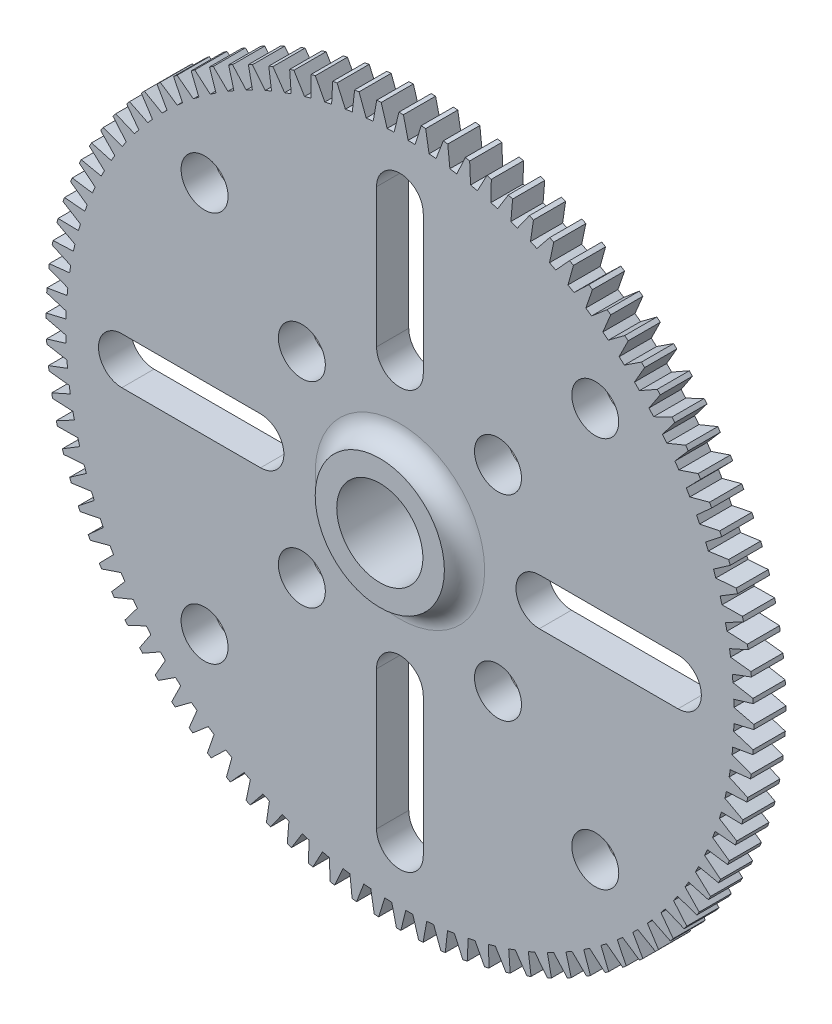
from build123d import *

# Parameters (mm, degrees)
SKETCH1_R          = 32.1437
EXTRUDE1_DEPTH     = 2.921
CUT_EXTRUDE1_DEPTH = 46.551807213
CIRPATTERN1_COUNT  = 100
SKETCH4_R          = 5.8674
EXTRUDE2_DEPTH     = 1.8288
FILLET1_R          = 1.8288
FILLET2_R          = 1.8288
SKETCH5_R          = 3.9116
CUT_EXTRUDE3_DEPTH = 46.931610872
CUT_EXTRUDE4_REACH = 47.706
CIRPATTERN2_COUNT  = 4
CUT_EXTRUDE5_REACH = 47.706
SKETCH7_R          = 2.1336
CIRPATTERN3_COUNT  = 4


with BuildPart() as part:
    # Sketch1 → Extrude1 (new body)
    with BuildSketch(Plane.XY):
        Circle(SKETCH1_R)
    extrude(amount=EXTRUDE1_DEPTH)

    # Sketch3 → Cut-Extrude1 (cut, through all)
    with BuildSketch(Plane(origin=(0, 0, 0), x_dir=(-1, 0, 0), z_dir=(0, 0, -1))):
        with BuildLine():
            Line((0.743775686, -30.337596874), (0.3175, -32.142131906))
            ThreePointArc((0.3175, -32.142131906), (1.123975208, -32.124042856), (1.929742527, -32.085721801))
            Line((1.929742527, -32.085721801), (1.378387358, -30.315392702))
            ThreePointArc((1.378387358, -30.315392702), (1.061139601, -30.328154727), (0.743775686, -30.337596874))
        make_face()
    cut_extrude1 = extrude(amount=-CUT_EXTRUDE1_DEPTH, mode=Mode.SUBTRACT)

    # CirPattern1: Cut-Extrude1 ×100 about axis
    cirpattern1_axis = Axis((0, 0, 0), (0, 0, 1))
    for i in range(1, CIRPATTERN1_COUNT):
        add(cut_extrude1.rotate(cirpattern1_axis, i * 360 / CIRPATTERN1_COUNT), mode=Mode.SUBTRACT)

    # Sketch4 → Extrude2 (add)
    with BuildSketch(Plane(origin=(0, 0, 0), x_dir=(-1, 0, 0), z_dir=(0, 0, -1))):
        with Locations(Location((0, 0, 0), (0, 0, 180))):
            Circle(SKETCH4_R)
    extrude2 = extrude(amount=EXTRUDE2_DEPTH)

    # Fillet1
    fillet1_edges = [part.edges().sort_by_distance(p)[0] for p in [
        (-5.8674, 0, 0),
    ]]
    fillet(fillet1_edges, radius=FILLET1_R - 0.0001)  # a hair under: the kernel refuses the full size

    # Mirror3: Extrude2 across plane
    add(extrude2.mirror(Plane(origin=(0, 0, 1.4605), x_dir=(1, 0, 0), z_dir=(0, 0, -1))))

    # Fillet2
    fillet2_edges = [part.edges().sort_by_distance(p)[0] for p in [
        (-5.8674, 0, 2.921),
    ]]
    fillet(fillet2_edges, radius=FILLET2_R - 0.0001)  # a hair under: the kernel refuses the full size

    # Sketch5 → Cut-Extrude3 (cut, through all)
    with BuildSketch(Plane(origin=(0, 0, -1.8288), x_dir=(-1, 0, 0), z_dir=(0, 0, -1))):
        Circle(SKETCH5_R)
    extrude(amount=-CUT_EXTRUDE3_DEPTH, mode=Mode.SUBTRACT)

    # Sketch6 → Cut-Extrude4 (cut, up to next)
    with BuildSketch(Plane.XY.offset(2.921), mode=Mode.PRIVATE) as cut_extrude4_sk1:
        with BuildLine():
            Line((-25.2603, -2.1209), (-12.6619, -2.1209))
            ThreePointArc((-12.6619, -2.1209), (-10.541, 0), (-12.6619, 2.1209))
            Line((-12.6619, 2.1209), (-25.2603, 2.1209))
            ThreePointArc((-25.2603, 2.1209), (-27.3812, 0), (-25.2603, -2.1209))
        make_face()
    cut_extrude4_tool1 = extrude(cut_extrude4_sk1.sketch, amount=-CUT_EXTRUDE4_REACH, mode=Mode.PRIVATE) & part.part
    cut_extrude4 = cut_extrude4_tool1.solids().sort_by_distance((-18.9611, 0, 2.921))[0]
    add(cut_extrude4, mode=Mode.SUBTRACT)

    # CirPattern2: Cut-Extrude4 ×4 about axis
    cirpattern2_axis = Axis((0, 0, 0), (0, 0, 1))
    for i in range(1, CIRPATTERN2_COUNT):
        add(cut_extrude4.rotate(cirpattern2_axis, i * 360 / CIRPATTERN2_COUNT), mode=Mode.SUBTRACT)

    # Sketch7 → Cut-Extrude5 (cut, up to next)
    with BuildSketch(Plane.XY.offset(2.921), mode=Mode.PRIVATE) as cut_extrude5_sk1:
        with Locations((-8.908414072, 8.908414072)):
            Circle(SKETCH7_R)
    cut_extrude5_tool1 = extrude(cut_extrude5_sk1.sketch, amount=-CUT_EXTRUDE5_REACH, mode=Mode.PRIVATE) & part.part
    # Sketch7 → Cut-Extrude5 (cut, up to next)
    with BuildSketch(Plane.XY.offset(2.921), mode=Mode.PRIVATE) as cut_extrude5_sk2:
        with Locations((-17.744986095, 17.744986095)):
            Circle(SKETCH7_R)
    cut_extrude5_tool2 = extrude(cut_extrude5_sk2.sketch, amount=-CUT_EXTRUDE5_REACH, mode=Mode.PRIVATE) & part.part
    cut_extrude5_1 = cut_extrude5_tool1.solids().sort_by_distance((-8.908414, 8.908414, 2.921))[0]
    add(cut_extrude5_1, mode=Mode.SUBTRACT)
    cut_extrude5_2 = cut_extrude5_tool2.solids().sort_by_distance((-17.744986, 17.744986, 2.921))[0]
    add(cut_extrude5_2, mode=Mode.SUBTRACT)
    cut_extrude5 = cut_extrude5_1 + cut_extrude5_2  # Cut-Extrude5 as one shape, for the pattern or mirror that repeats it

    # CirPattern3: Cut-Extrude5 ×4 about axis
    cirpattern3_axis = Axis((0, 0, 0), (0, 0, 1))
    for i in range(1, CIRPATTERN3_COUNT):
        add(cut_extrude5.rotate(cirpattern3_axis, i * 360 / CIRPATTERN3_COUNT), mode=Mode.SUBTRACT)


solid = part.part
